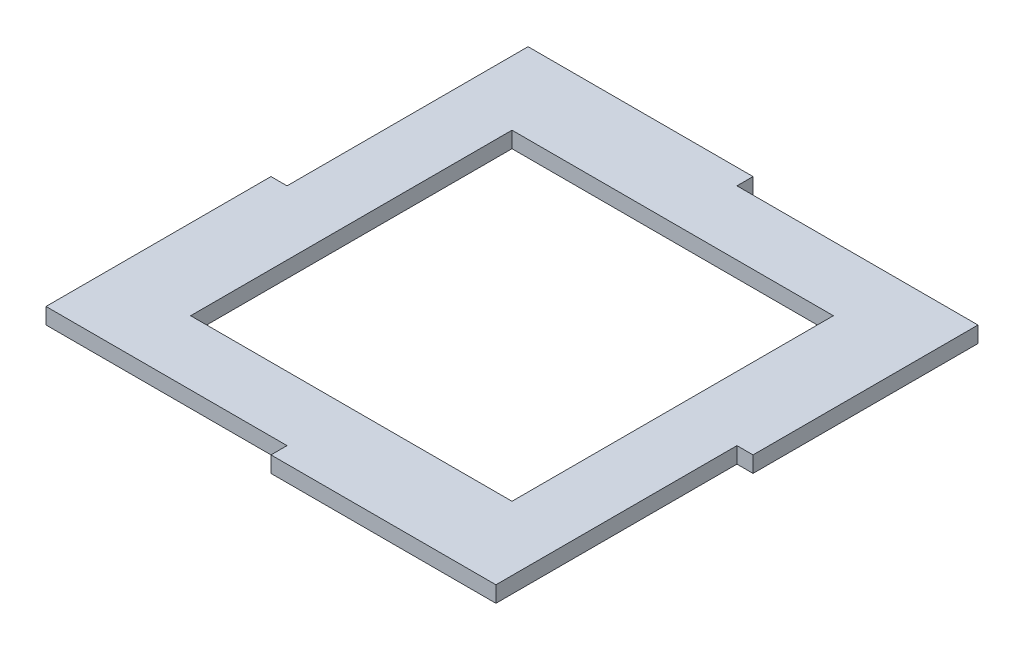
from build123d import *

# Parameters (mm, degrees)
SKETCH1_W           = 127
SKETCH1_H           = 127
BOSS_EXTRUDE1_DEPTH = 6.35


with BuildPart() as part:
    # Sketch1 → Boss-Extrude1 (new body)
    with BuildSketch(Plane(origin=(0, 0, 0), x_dir=(1, 0, 0), z_dir=(0, 1, 0))):
        Polygon((-112.506214689, 99.662711864), (-112.506214689, 4.412711864), (-118.856214689, 4.412711864), (-118.856214689, -84.487288136), (-23.606214689, -84.487288136), (-23.606214689, -90.837288136), (65.293785311, -90.837288136), (65.293785311, 4.412711864), (71.643785311, 4.412711864), (71.643785311, 93.312711864), (-23.606214689, 93.312711864), (-23.606214689, 99.662711864), align=None)
        with Locations((-23.606214689, 4.412711864)):
            Rectangle(SKETCH1_W, SKETCH1_H, mode=Mode.SUBTRACT)
    extrude(amount=BOSS_EXTRUDE1_DEPTH)


solid = part.part
